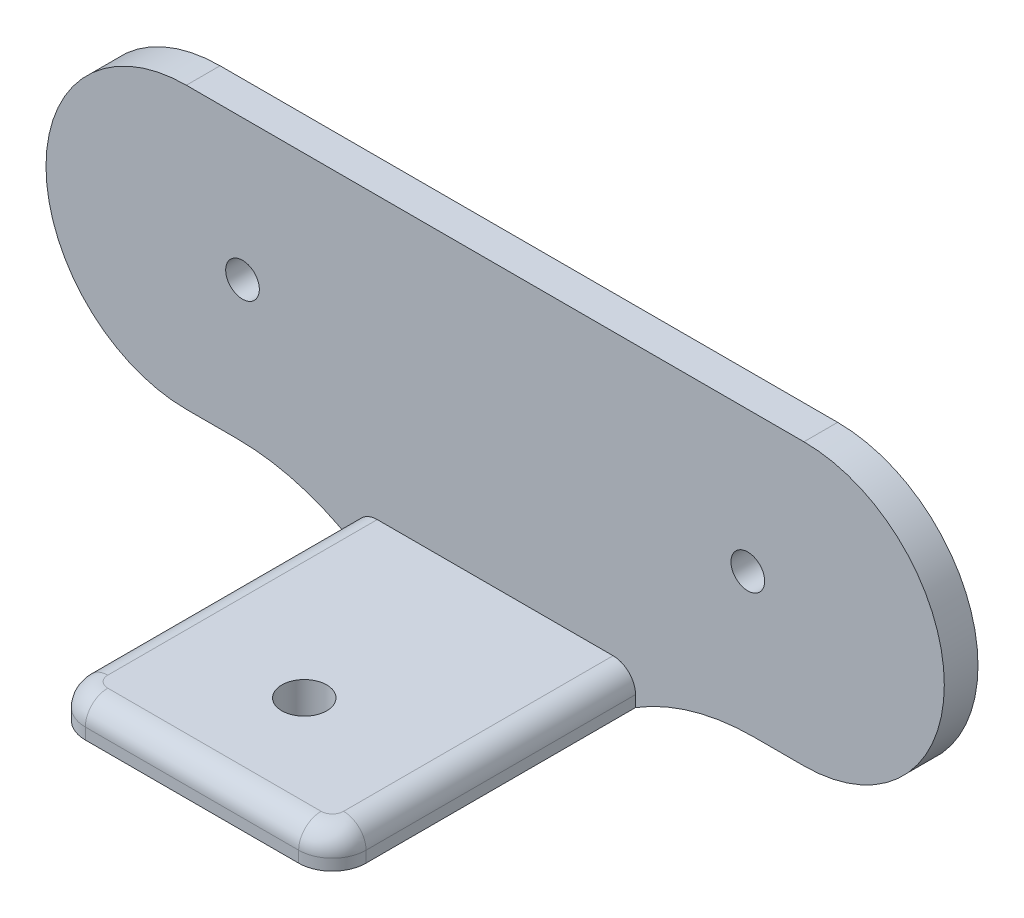
from build123d import *

# Parameters (mm, degrees)
BOSS_EXTRU_1_DEPTH      = 3
ESQUISSE2_R             = 1.5
ENL_V_MAT_EXTRU_1_DEPTH = 48.265209192
BOSS_EXTRU_2_DEPTH      = 3
CONG_1_R                = 20
ESQUISSE4_R             = 2
ENL_V_MAT_EXTRU_2_DEPTH = 56.901699437
CONG_3_R                = 2


with BuildPart() as part:
    # Esquisse1 → Boss.-Extru.1 (new body)
    with BuildSketch(Plane.XY):
        with BuildLine():
            Line((-27.5, 0), (27.5, 0))
            ThreePointArc((27.5, 0), (40, -12.5), (27.5, -25))
            Line((27.5, -25), (-27.5, -25))
            ThreePointArc((-27.5, -25), (-40, -12.5), (-27.5, 0))
        make_face()
    extrude(amount=BOSS_EXTRU_1_DEPTH)

    # Esquisse2 → Enlèv. mat.-Extru.1 (cut, through all)
    with BuildSketch(Plane.XY.offset(3)):
        with Locations((-22.5, -12.5)):
            Circle(ESQUISSE2_R)
        with Locations((22.5, -12.5)):
            Circle(ESQUISSE2_R)
    extrude(amount=-ENL_V_MAT_EXTRU_1_DEPTH, mode=Mode.SUBTRACT)

    # Esquisse3 → Boss.-Extru.2 (add)
    with BuildSketch(Plane.XZ.offset(25)):
        with BuildLine():
            Line((-12.5, 0), (12.5, 0))
            Line((12.5, 0), (12.5, 27))
            ThreePointArc((12.5, 27), (11.621320344, 29.121320344), (9.5, 30))
            Line((9.5, 30), (-9.5, 30))
            ThreePointArc((-9.5, 30), (-11.621320344, 29.121320344), (-12.5, 27))
            Line((-12.5, 27), (-12.5, 0))
        make_face()
    extrude(amount=BOSS_EXTRU_2_DEPTH)

    # Congé1
    # the kernel refuses this fillet: 20 mm, written as the material it adds along each edge
    with BuildSketch(Plane(origin=(12.5, -25, 0), x_dir=(1, 0, 0), z_dir=(0, 0, 1)), Plane(origin=(-12.5, -25, 3), x_dir=(-1, 0, 0), z_dir=(0, 0, -1))) as cong_1_piece_1:
        with BuildLine():
            CenterArc((10.535653753, -20), CONG_1_R, 90, 31.788330617)
            Line((0, -3), (0, 0))
            Line((0, 0), (10.535653753, 0))
        make_face()
    extrude(amount=3)

    # Esquisse4 → Enlèv. mat.-Extru.2 (cut, through all)
    with BuildSketch(Plane(origin=(0, -25, 0), x_dir=(1, 0, 0), z_dir=(0, 1, 0))):
        with Locations(Location((0, -20, 0), (0, 0, 270))):
            Circle(ESQUISSE4_R)
    extrude(amount=-ENL_V_MAT_EXTRU_2_DEPTH, mode=Mode.SUBTRACT)

    # Congé3
    cong_3_edges = [part.edges().sort_by_distance(p)[0] for p in [
        (-12.5, -25, 15),
        (12.5, -25, 15),
        (11.621320344, -25, 29.121320344),
        (0, -25, 30),
        (-11.621320344, -25, 29.121320344),
    ]]
    fillet(cong_3_edges, radius=CONG_3_R)


solid = part.part
